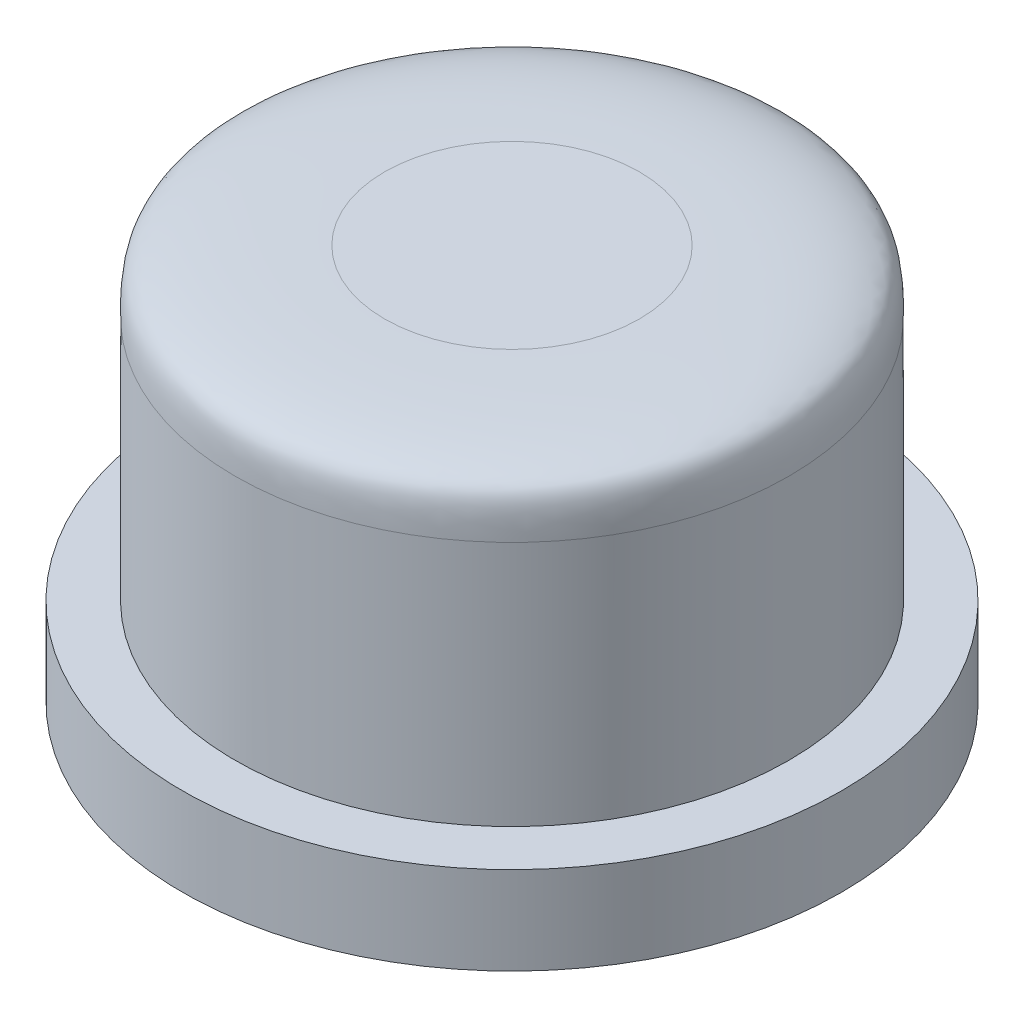
from build123d import *
from OCP.BRepAlgoAPI import BRepAlgoAPI_Cut
from OCP.TopTools import TopTools_ListOfShape


with BuildPart() as part:
    # 草图1 → 旋转1 (revolve)
    with BuildSketch(Plane.XY):
        Polygon((2.3, 0), (2.3, 0.9), (0, 0.9), (0, 4.5), (3.15, 4.5), (3.15, 1), (3.75, 1), (3.75, 0), align=None)
    revolve(axis=Axis((0, 0.9, 0), (0, 1, 0)))


with BuildPart() as cut_revolve_6_tool:
    # 草图2 → 切除-旋转6 (revolve)
    with BuildSketch(Plane.XY):
        with BuildLine():
            Line((1.45, 4.5), (3.15, 4.5))
            Line((3.15, 4.5), (3.15, 3.8))
            add(Edge.make_bspline(
                [(1.45, 4.5), (2.373616695, 4.5), (2.769590277, 4.433977798), (3.153202517, 4.267640833), (3.15, 4.025903219), (3.15, 3.8)],
                knots=[0, 0, 0, 0, 0.535445213, 0.635445213, 1, 1, 1, 1], degree=3))
        make_face()
    revolve(axis=Axis((0, 4.5, 0), (0, -1, 0)))


with BuildPart() as part_1:
    add(part.part)

    # 切除-旋转6: cut by cut_revolve_6_tool, with a tolerance
    cut_revolve_6_stock = TopTools_ListOfShape()
    cut_revolve_6_stock.Append(part_1.part.wrapped)
    cut_revolve_6_tools = TopTools_ListOfShape()
    cut_revolve_6_tools.Append(cut_revolve_6_tool.part.wrapped)
    cut_revolve_6_cut = BRepAlgoAPI_Cut()
    cut_revolve_6_cut.SetArguments(cut_revolve_6_stock)
    cut_revolve_6_cut.SetTools(cut_revolve_6_tools)
    cut_revolve_6_cut.SetFuzzyValue(0.00001)
    cut_revolve_6_cut.Build()
    add(Compound.cast(cut_revolve_6_cut.Shape()).solids(), mode=Mode.REPLACE)


solid = part_1.part
